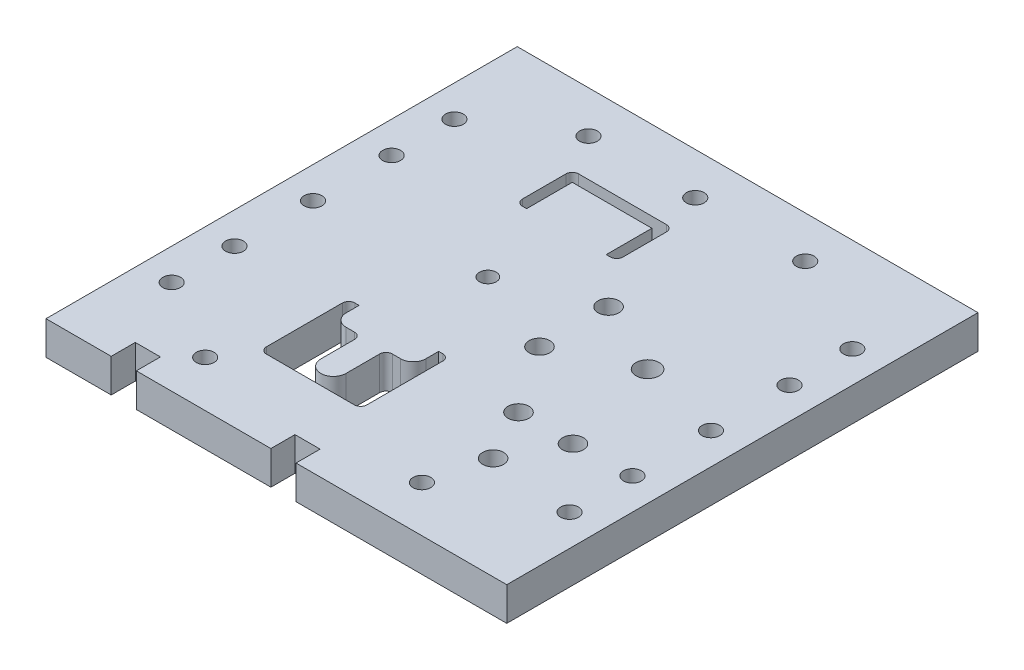
from build123d import *

# Parameters (mm, degrees)
SKETCH1_W              = 220
SKETCH1_H              = 225
BOSS_EXTRUDE1_DEPTH    = 16
CUT_EXTRUDE1_REACH     = 160.153
SKETCH2_R              = 4
CUT_EXTRUDE2_REACH     = 160.153
SKETCH3_W              = 12
SKETCH3_H              = 11.5
LPATTERN1_COUNT        = 2
LPATTERN1_PITCH        = 76.25
SKETCH4_R              = 8.5
CUT_EXTRUDE3_DEPTH     = 5
M10_TAPPED_HOLE2_D     = 8.5
M10_TAPPED_HOLE3_D     = 8.5
M10_TAPPED_HOLE4_D     = 8.5
CUT_EXTRUDE4_REACH     = 160.153
CUT_EXTRUDE6_REACH     = 160.153
F_10_0MM_DOWEL_HOLE1_D = 10
CUT_EXTRUDE7_REACH     = 160.153
SKETCH34_R             = 5


with BuildPart() as part:
    # Sketch1 → Boss-Extrude1 (new body)
    with BuildSketch(Plane(origin=(0, 0, 0), x_dir=(1, 0, 0), z_dir=(0, 1, 0))):
        Rectangle(SKETCH1_W, SKETCH1_H)
    extrude(amount=-BOSS_EXTRUDE1_DEPTH)

    # Sketch2 → Cut-Extrude1 (cut, up to next)
    with BuildSketch(Plane(origin=(0, 0, 0), x_dir=(1, 0, 0), z_dir=(0, 1, 0)), mode=Mode.PRIVATE) as cut_extrude1_sk1:
        with Locations((-21.75, 10.23)):
            Circle(SKETCH2_R)
    cut_extrude1_tool1 = extrude(cut_extrude1_sk1.sketch, amount=-CUT_EXTRUDE1_REACH, mode=Mode.PRIVATE) & part.part
    add(cut_extrude1_tool1.solids().sort_by_distance((-21.75, 0, -10.23))[0], mode=Mode.SUBTRACT)

    # Sketch3 → Cut-Extrude2 (cut, up to next)
    with BuildSketch(Plane.XZ.offset(16), mode=Mode.PRIVATE) as cut_extrude2_sk1:
        with Locations((3.38, 106.75)):
            Rectangle(SKETCH3_W, SKETCH3_H)
    cut_extrude2_tool1 = extrude(cut_extrude2_sk1.sketch, amount=-CUT_EXTRUDE2_REACH, mode=Mode.PRIVATE) & part.part
    cut_extrude2 = cut_extrude2_tool1.solids().sort_by_distance((3.38, -16, 106.75))[0]
    add(cut_extrude2, mode=Mode.SUBTRACT)

    # LPattern1: Cut-Extrude2 ×2
    with Locations(*[(-i * LPATTERN1_PITCH, 0, 0) for i in range(1, LPATTERN1_COUNT)]):
        add(cut_extrude2, mode=Mode.SUBTRACT)

    # Sketch4 → Cut-Extrude3 (cut)
    with BuildSketch(Plane.XZ.offset(16)):
        with Locations((-21.75, 100)):
            Circle(SKETCH4_R)
        with Locations((25, 100)):
            Circle(SKETCH4_R)
        with Locations((70, 100)):
            Circle(SKETCH4_R)
        with Locations((-21.75, -100)):
            Circle(SKETCH4_R)
        with Locations((25, -100)):
            Circle(SKETCH4_R)
        with Locations((70, -100)):
            Circle(SKETCH4_R)
        with Locations((-98, 100)):
            Circle(SKETCH4_R)
        with Locations((-98, -100)):
            Circle(SKETCH4_R)
    extrude(amount=-CUT_EXTRUDE3_DEPTH, mode=Mode.SUBTRACT)

    # M10 Tapped Hole2 (through all)
    with Locations(Plane(origin=(0, 0, 0), x_dir=(1, 0, 0), z_dir=(0, 1, 0))):
        with Locations((-95, -67.5), (-95, -37.5), (-95, 0), (-95, 37.5), (-95, 67.5), (95, 67.5), (95, 37.5), (95, 0), (95, -37.5), (95, -67.5)):
            Hole(M10_TAPPED_HOLE2_D / 2)

    # M10 Tapped Hole3 (through all)
    with Locations(Plane(origin=(0, 0, 0), x_dir=(1, 0, 0), z_dir=(0, 1, 0))):
        with Locations((-56, 92.5), (-5, 92.5), (47.5, 92.5)):
            Hole(M10_TAPPED_HOLE3_D / 2)

    # M10 Tapped Hole4 (through all)
    with Locations(Plane(origin=(0, 0, 0), x_dir=(1, 0, 0), z_dir=(0, 1, 0))):
        with Locations((47.5, -90.5), (-56, -90.5)):
            Hole(M10_TAPPED_HOLE4_D / 2)

    # Sketch24 → Cut-Extrude4 (cut, up to next)
    with BuildSketch(Plane(origin=(0, 0, 0), x_dir=(1, 0, 0), z_dir=(0, 1, 0)), mode=Mode.PRIVATE) as cut_extrude4_sk1:
        with BuildLine():
            Line((2.25, -35.27), (2.25, -71.53))
            ThreePointArc((2.25, -71.53), (1.371320344, -73.651320344), (-0.75, -74.53))
            Line((-0.75, -74.53), (-42.75, -74.53))
            ThreePointArc((-42.75, -74.53), (-44.871320344, -73.651320344), (-45.75, -71.53))
            Line((-45.75, -71.53), (-45.75, -35.27))
            ThreePointArc((-45.75, -35.27), (-44.871320344, -33.148679656), (-42.75, -32.27))
            Line((-42.75, -32.27), (-40.75, -32.27))
            Line((-40.75, -32.27), (-40.75, -38.4))
            ThreePointArc((-40.75, -38.4), (-38.992640687, -42.642640687), (-34.75, -44.4))
            Line((-34.75, -44.4), (-30.75, -44.4))
            ThreePointArc((-30.75, -44.4), (-28.628679656, -45.278679656), (-27.75, -47.4))
            Line((-27.75, -47.4), (-27.75, -63.53))
            ThreePointArc((-27.75, -63.53), (-21.75, -69.53), (-15.75, -63.53))
            Line((-15.75, -63.53), (-15.75, -47.4))
            ThreePointArc((-15.75, -47.4), (-14.871320344, -45.278679656), (-12.75, -44.4))
            Line((-12.75, -44.4), (-8.75, -44.4))
            ThreePointArc((-8.75, -44.4), (-4.507359313, -42.642640687), (-2.75, -38.4))
            Line((-2.75, -38.4), (-2.75, -32.27))
            Line((-2.75, -32.27), (-0.75, -32.27))
            ThreePointArc((-0.75, -32.27), (1.371320344, -33.148679656), (2.25, -35.27))
        make_face()
    cut_extrude4_tool1 = extrude(cut_extrude4_sk1.sketch, amount=-CUT_EXTRUDE4_REACH, mode=Mode.PRIVATE) & part.part
    add(cut_extrude4_tool1.solids().sort_by_distance((-21.75, 0, 70.169524))[0], mode=Mode.SUBTRACT)

    # Sketch29 → Cut-Extrude6 (cut, up to next)
    with BuildSketch(Plane.XZ.offset(16), mode=Mode.PRIVATE) as cut_extrude6_sk1:
        with BuildLine():
            Line((-2.75, -47.73), (-0.75, -47.73))
            ThreePointArc((-0.75, -47.73), (1.371320344, -48.608679656), (2.25, -50.73))
            Line((2.25, -50.73), (2.25, -71.53))
            ThreePointArc((2.25, -71.53), (1.371320344, -73.651320344), (-0.75, -74.53))
            Line((-0.75, -74.53), (-42.75, -74.53))
            ThreePointArc((-42.75, -74.53), (-44.871320344, -73.651320344), (-45.75, -71.53))
            Line((-45.75, -71.53), (-45.75, -50.73))
            ThreePointArc((-45.75, -50.73), (-44.871320344, -48.608679656), (-42.75, -47.73))
            Line((-42.75, -47.73), (-40.75, -47.73))
            Line((-40.75, -47.73), (-40.75, -69.53))
            Line((-40.75, -69.53), (-2.75, -69.53))
            Line((-2.75, -69.53), (-2.75, -47.73))
        make_face()
    cut_extrude6_tool1 = extrude(cut_extrude6_sk1.sketch, amount=-CUT_EXTRUDE6_REACH, mode=Mode.PRIVATE) & part.part
    add(cut_extrude6_tool1.solids().sort_by_distance((-1.75, -16, -48.279749))[0], mode=Mode.SUBTRACT)

    # Ø10.0mm Dowel Hole1 (through all)
    with Locations(Plane(origin=(0, 0, 0), x_dir=(1, 0, 0), z_dir=(0, 1, 0))):
        with Locations((54.5, -63.53), (67.5, -38.4), (41.5, -38.4), (19.38, 26.73), (19.38, -6.27)):
            Hole(F_10_0MM_DOWEL_HOLE1_D / 2)

    # Sketch34 → Cut-Extrude7 (cut, up to next)
    with BuildSketch(Plane(origin=(0, 0, 0), x_dir=(1, 0, 0), z_dir=(0, 1, 0)), mode=Mode.PRIVATE) as cut_extrude7_sk1:
        with Locations((54.5, 10.23)):
            Circle(SKETCH34_R)
    cut_extrude7_tool1 = extrude(cut_extrude7_sk1.sketch, amount=-CUT_EXTRUDE7_REACH, mode=Mode.PRIVATE) & part.part
    add(cut_extrude7_tool1.solids().sort_by_distance((54.5, 0, -10.23))[0], mode=Mode.SUBTRACT)

    # Cut-Sweep1: sweep along a curve in space
    with BuildLine() as cut_sweep1_path:
        ThreePointArc((54.5, 0, -5.23), (58.035533906, 0, -6.694466094), (59.5, 0, -10.23))
        ThreePointArc((59.5, 0, -10.23), (58.035533906, 0, -13.765533906), (54.5, 0, -15.23))
        ThreePointArc((54.5, 0, -15.23), (50.964466094, 0, -13.765533906), (49.5, 0, -10.23))
        ThreePointArc((49.5, 0, -10.23), (50.964466094, 0, -6.694466094), (54.5, 0, -5.23))
    # Sketch35 → Cut-Sweep1 (sweep, cut)
    with BuildSketch(Plane.XY.offset(-10.23)):
        Polygon((59.5, -10), (60.024077793, 0), (59.5, 0), align=None)
    sweep(path=cut_sweep1_path.line, mode=Mode.SUBTRACT)


solid = part.part
